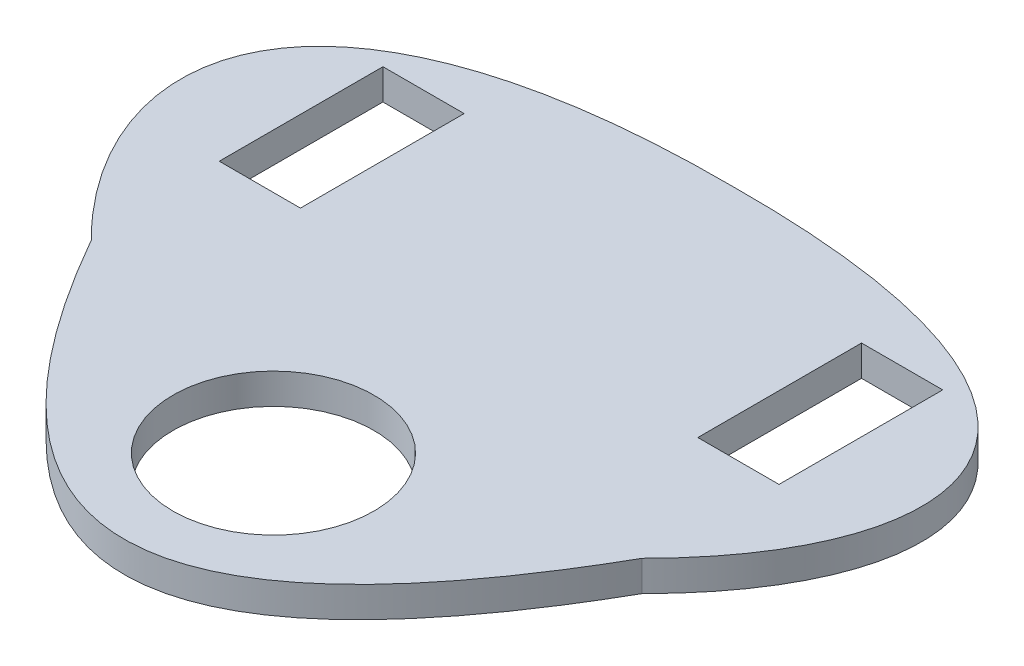
from build123d import *

# Parameters (mm, degrees)
SKETCH1_R           = 16.417308476
SKETCH1_W           = 13.264801626
SKETCH1_H           = 26.744852982
SKETCH1_W_2         = 13.264801627
BOSS_EXTRUDE1_DEPTH = 5


with BuildPart() as part:
    # Sketch1 → Boss-Extrude1 (new body)
    with BuildSketch(Plane(origin=(0, 0, 0), x_dir=(1, 0, 0), z_dir=(0, 1, 0))):
        with BuildLine():
            add(Edge.make_bspline(
                [(-50.763553632, 0), (-5.763553632, -79.235152429), (39.236446368, 0)],
                knots=[0, 0, 0, 1, 1, 1], degree=2))
            add(Edge.make_bspline(
                [(39.236446368, 0), (65.398688251, 26.049823561), (63.440320284, 60.482028786), (-5.763553632, 60)],
                knots=[0, 0, 0, 0, 1, 1, 1, 1], degree=3))
            add(Edge.make_bspline(
                [(-50.763553632, 0), (-76.925795516, 26.049823561), (-74.967427548, 60.482028786), (-5.763553632, 60)],
                knots=[0, 0, 0, 0, 1, 1, 1, 1], degree=3))
        make_face()
        with Locations((-5.763553632, -15.237324398)):
            Circle(SKETCH1_R, mode=Mode.SUBTRACT)
        with Locations((33.327885176, 35)):
            Rectangle(SKETCH1_W, SKETCH1_H, mode=Mode.SUBTRACT)
        with Locations((-44.85499244, 35)):
            Rectangle(SKETCH1_W_2, SKETCH1_H, mode=Mode.SUBTRACT)
    extrude(amount=BOSS_EXTRUDE1_DEPTH)


solid = part.part
